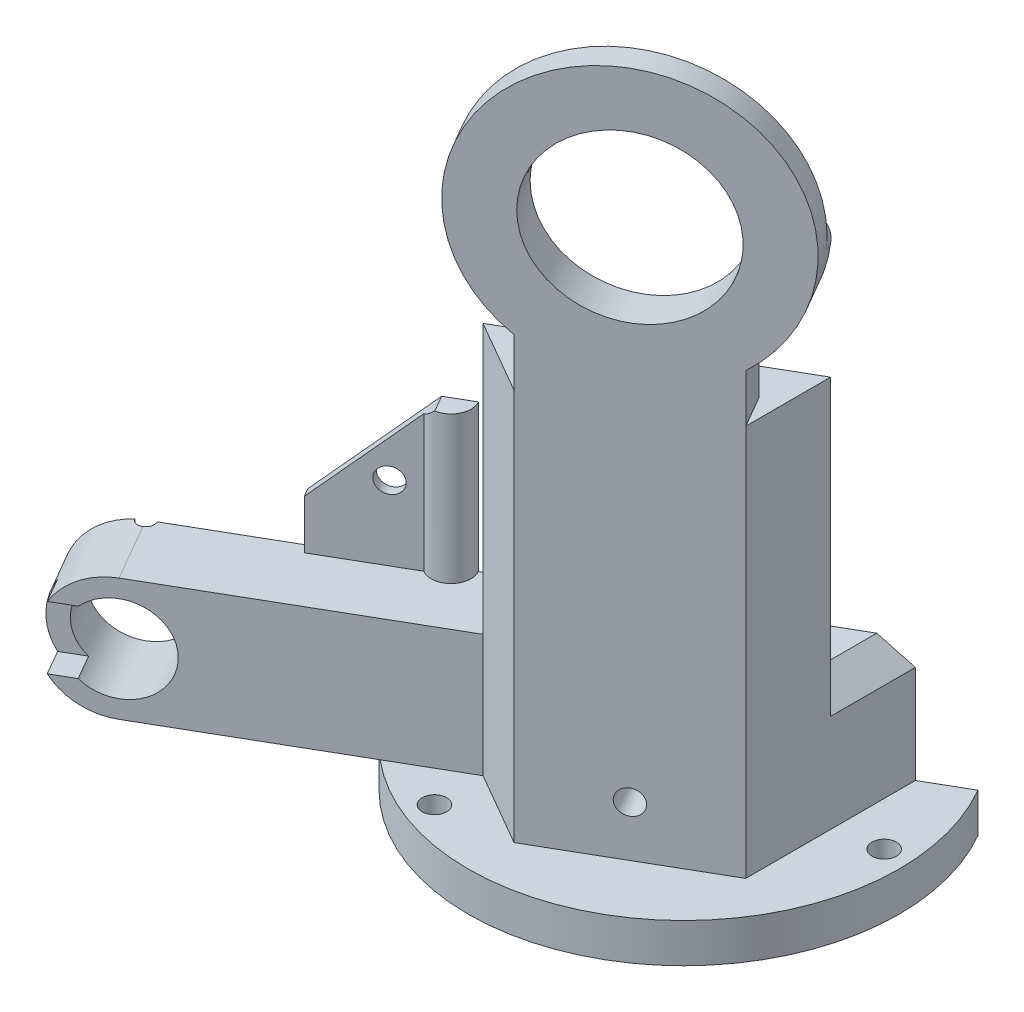
from build123d import *

# Parameters (mm, degrees)
SKETCH4_R            = 55.88
BOSS_EXTRUDE2_DEPTH  = 10.16
BOSS_EXTRUDE4_DEPTH  = 101.6
BOSS_EXTRUDE5_DEPTH  = 9.525
BOSS_EXTRUDE6_START  = -9.525
BOSS_EXTRUDE6_DEPTH  = 9.525
CUT_EXTRUDE4_REACH   = 223.16
SKETCH12_R           = 21.5
SKETCH13_W           = 38.1
SKETCH13_H           = 69.85
CUT_EXTRUDE5_DEPTH   = 76.2
BOSS_EXTRUDE10_DEPTH = 19.05
SKETCH28_R           = 11.2395
CUT_EXTRUDE9_DEPTH   = 38.1
CUT_EXTRUDE10_DEPTH  = 7.366
CHAMFER1_SIZE        = 6.35
SKETCH30_R           = 2.1
CUT_EXTRUDE11_DEPTH  = 7.366
SKETCH31_R           = 3.175
CUT_EXTRUDE12_DEPTH  = 223.900333216
BOSS_EXTRUDE11_DEPTH = 38.1
CHAMFER2_SIZE        = 25.4
CUT_EXTRUDE13_REACH  = 233.204
SKETCH34_R           = 3.175
SKETCH35_R           = 3.175
CUT_EXTRUDE14_DEPTH  = 246.746626534
SKETCH36_W           = 63.5
SKETCH36_H           = 36.709955102
CUT_EXTRUDE15_DEPTH  = 63.5
FILLET1_R            = 6.35
SKETCH37_W           = 210.742334846
SKETCH37_H           = 201.224939079
CUT_EXTRUDE16_DEPTH  = 232.093968202


with BuildPart() as part:
    # Sketch4 → Boss-Extrude2 (new body)
    with BuildSketch(Plane(origin=(0, 0, 0), x_dir=(1, 0, 0), z_dir=(0, 1, 0))):
        with Locations(Location((0, 0, 0), (0, 0, 270))):
            Circle(SKETCH4_R)
    extrude(amount=BOSS_EXTRUDE2_DEPTH)

    # Sketch8 → Boss-Extrude4 (add)
    with BuildSketch(Plane(origin=(0, 10.16, 0), x_dir=(1, 0, 0), z_dir=(0, 1, 0))):
        Polygon((0, 43.994090512), (-38.1, 21.997045256), (-38.1, -21.997045256), (0, -43.994090512), (38.1, -21.997045256), (38.1, 21.997045256), align=None)
    extrude(amount=BOSS_EXTRUDE4_DEPTH)

    # Sketch9 → Boss-Extrude5 (add)
    with BuildSketch(Plane(origin=(-19.05, 0, -32.995567884), x_dir=(-0.8660254037844386, 0, 0.5000000000000003), z_dir=(-0.5000000000000002, 0, -0.8660254037844385))):
        with BuildLine():
            Line((21.997045256, 111.76), (-21.997045256, 111.76))
            Line((-21.997045256, 111.76), (-21.997045256, 124.225996336))
            ThreePointArc((-21.997045256, 124.225996336), (0, 188.144153123), (21.997045256, 124.225996336))
            Line((21.997045256, 124.225996336), (21.997045256, 111.76))
        make_face()
    extrude(amount=-BOSS_EXTRUDE5_DEPTH)

    # Sketch10 → Boss-Extrude6 (add)
    with BuildSketch(Plane(origin=(19.05, 0, 32.995567884), x_dir=(0.8660254037844386, 0, -0.5000000000000001), z_dir=(0.5000000000000001, 0, 0.8660254037844386)).offset(BOSS_EXTRUDE6_START)):
        with BuildLine():
            Line((-21.997045256, 111.76), (21.997045256, 111.76))
            Line((21.997045256, 111.76), (21.997045256, 124.225996336))
            ThreePointArc((21.997045256, 124.225996336), (0, 188.144153123), (-21.997045256, 124.225996336))
            Line((-21.997045256, 124.225996336), (-21.997045256, 111.76))
        make_face()
    extrude(amount=BOSS_EXTRUDE6_DEPTH)

    # Cut-Extrude4: up to this face of the body (flat: up to its plane)
    cut_extrude4_end = Plane(part.part.faces().sort_by_distance((19.05, 104.643172711, 32.995567884))[0])
    # Sketch12 → Cut-Extrude4 (cut, up to the picked face)
    with BuildSketch(Plane(origin=(-19.05, 0, -32.995567884), x_dir=(-0.8660254037844386, 0, 0.5000000000000003), z_dir=(-0.5000000000000002, 0, -0.8660254037844385)), mode=Mode.PRIVATE) as cut_extrude4_sk1:
        with Locations((0, 152.4)):
            Circle(SKETCH12_R)
    cut_extrude4_tool1 = split(extrude(cut_extrude4_sk1.sketch, amount=-CUT_EXTRUDE4_REACH, mode=Mode.PRIVATE), bisect_by=cut_extrude4_end, keep=Keep.BOTH, mode=Mode.PRIVATE)
    add(cut_extrude4_tool1.solids().sort_by(Axis((-19.05, 152.4, -32.995568), (0.5000000000000002, 0, 0.8660254037844385)))[0], mode=Mode.SUBTRACT)

    # Sketch13 → Cut-Extrude5 (cut, symmetric)
    with BuildSketch(Plane(origin=(-19.05, 0, 10.998522628), x_dir=(0.5000000000000002, 0, 0.8660254037844386), z_dir=(-0.8660254037844385, 0, 0.5000000000000001))):
        with Locations((0, 76.835)):
            Rectangle(SKETCH13_W, SKETCH13_H)
    extrude(amount=CUT_EXTRUDE5_DEPTH, both=True, mode=Mode.SUBTRACT)

    # Sketch22 → Boss-Extrude10 (add, symmetric)
    with BuildSketch(Plane(origin=(0, 0, 0), x_dir=(-0.8660254037844386, 0, 0.5000000000000001), z_dir=(-0.5000000000000001, 0, -0.8660254037844386))):
        with BuildLine():
            Line((43.994090512, 41.91), (102.10102108, 41.91))
            ThreePointArc((102.10102108, 41.91), (117.97602108, 26.035), (102.10102108, 10.16))
            Line((102.10102108, 10.16), (43.994090512, 10.16))
            Line((43.994090512, 10.16), (21.997045256, 10.16))
            Line((21.997045256, 10.16), (21.997045256, 41.91))
            Line((21.997045256, 41.91), (43.994090512, 41.91))
        make_face()
    extrude(amount=BOSS_EXTRUDE10_DEPTH, both=True)

    # Sketch28 → Cut-Extrude9 (cut)
    with BuildSketch(Plane(origin=(9.525, 0, 16.497783942), x_dir=(0.8660254037844386, 0, -0.5000000000000001), z_dir=(0.5000000000000001, 0, 0.8660254037844386))):
        with Locations((-102.10102108, 26.035)):
            Circle(SKETCH28_R)
    extrude(amount=-CUT_EXTRUDE9_DEPTH, mode=Mode.SUBTRACT)

    # Sketch29 → Cut-Extrude10 (cut)
    with BuildSketch(Plane(origin=(9.525, 0, 16.497783942), x_dir=(0.8660254037844386, 0, -0.5000000000000001), z_dir=(0.5000000000000001, 0, 0.8660254037844386))):
        with BuildLine():
            Line((-115.737415068, 17.907), (-109.863879848, 17.907))
            ThreePointArc((-109.863879848, 17.907), (-113.34052108, 26.035), (-109.863879848, 34.163))
            Line((-109.863879848, 34.163), (-115.737415068, 34.163))
            ThreePointArc((-115.737415068, 34.163), (-117.97602108, 26.035), (-115.737415068, 17.907))
        make_face()
    extrude(amount=-CUT_EXTRUDE10_DEPTH, mode=Mode.SUBTRACT)

    # Chamfer1
    chamfer1_edges = [part.edges().sort_by_distance(p)[0] for p in [
        (38.1, 41.91, -10.998522628),
        (28.575, 41.91, -27.49630657),
    ]]
    chamfer(chamfer1_edges, length=CHAMFER1_SIZE)

    # Sketch30 → Cut-Extrude11 (cut)
    with BuildSketch(Plane(origin=(0, 41.91, 0), x_dir=(1, 0, 0), z_dir=(0, 1, 0))):
        with Locations(Location((-88.422078008, -51.05051054, 0), (0, 0, 270))):
            Circle(SKETCH30_R)
    extrude(amount=-CUT_EXTRUDE11_DEPTH, mode=Mode.SUBTRACT)

    # Sketch31 → Cut-Extrude12 (cut, through all)
    with BuildSketch(Plane(origin=(0, 10.16, 0), x_dir=(1, 0, 0), z_dir=(0, 1, 0))):
        with Locations(Location((-49.089000823, 6.594762938, 0), (0, 0, 270))):
            Circle(SKETCH31_R)
        with Locations(Location((26.925278647, 41.57222955, 0), (0, 0, 270))):
            Circle(SKETCH31_R)
    cut_extrude12 = extrude(amount=-CUT_EXTRUDE12_DEPTH, mode=Mode.SUBTRACT)

    # Mirror1: Cut-Extrude12 across plane
    add(cut_extrude12.mirror(Plane(origin=(0, 0, 0), x_dir=(-0.8660254037844386, 0, 0.5000000000000001), z_dir=(-0.5000000000000001, 0, -0.8660254037844386))), mode=Mode.SUBTRACT)

    # Sketch33 → Boss-Extrude11 (add)
    with BuildSketch(Plane(origin=(0, 41.91, 0), x_dir=(1, 0, 0), z_dir=(0, 1, 0))):
        with BuildLine():
            Line((-43.411916389, -22.079834386), (-63.092428819, -33.442383535))
            Line((-63.092428819, -33.442383535), (-61.800298466, -35.680418955))
            Line((-61.800298466, -35.680418955), (-60.542722832, -37.858603849))
            Line((-60.542722832, -37.858603849), (-40.91541904, -26.504074545))
            ThreePointArc((-40.91541904, -26.504074545), (-33.742060338, -19.539834386), (-43.411916389, -22.079834386))
        make_face()
    extrude(amount=BOSS_EXTRUDE11_DEPTH)

    # Chamfer2
    chamfer2_edges = [part.edges().sort_by_distance(p)[0] for p in [
        (-61.817575825, 80.01, 35.650493692),
    ]]
    chamfer(chamfer2_edges, length=CHAMFER2_SIZE)

    # Cut-Extrude13: up to this plane
    cut_extrude13_end = Plane(origin=(-60.542722832, 80.01, 37.858603849), z_dir=(-0.500750644235671, 0, -0.8655915851587056))
    # Sketch34 → Cut-Extrude13 (cut, up to the surface)
    with BuildSketch(Plane(origin=(-1.292130352, 0, -2.23803542), x_dir=(-0.8660254037844386, 0, 0.5000000000000003), z_dir=(-0.5000000000000002, 0, -0.8660254037844385)), mode=Mode.PRIVATE) as cut_extrude13_sk1:
        with Locations((55.184849848, 61.159110234)):
            Circle(SKETCH34_R)
    cut_extrude13_tool1 = split(extrude(cut_extrude13_sk1.sketch, amount=-CUT_EXTRUDE13_REACH, mode=Mode.PRIVATE), bisect_by=cut_extrude13_end, keep=Keep.BOTH, mode=Mode.PRIVATE)
    add(cut_extrude13_tool1.solids().sort_by_distance((-49.083612, 61.15911, 25.35439))[0], mode=Mode.SUBTRACT)

    # Sketch35 → Cut-Extrude14 (cut, through all)
    with BuildSketch(Plane(origin=(19.05, 0, 32.995567884), x_dir=(0.8660254037844386, 0, -0.5000000000000001), z_dir=(0.5000000000000001, 0, 0.8660254037844386))):
        with Locations((0, 23.280078313)):
            Circle(SKETCH35_R)
    extrude(amount=-CUT_EXTRUDE14_DEPTH, mode=Mode.SUBTRACT)

    # Sketch36 → Cut-Extrude15 (cut, symmetric)
    with BuildSketch(Plane(origin=(-19.05, 0, 10.998522628), x_dir=(0.5000000000000004, 0, 0.8660254037844384), z_dir=(-0.8660254037844384, 0, 0.5000000000000004))):
        with Locations((0, 174.660846527)):
            Rectangle(SKETCH36_W, SKETCH36_H)
    extrude(amount=CUT_EXTRUDE15_DEPTH, both=True, mode=Mode.SUBTRACT)

    # Fillet1
    # the kernel refuses this fillet: 6.35 mm, written as the material it takes off along each edge
    with BuildSketch(Plane(origin=(12.272597523, 156.305868976, -21.027711652), x_dir=(0.04103819462533737, -0.9988766133891899, -0.023693412713994805), z_dir=(-0.5000000000000003, 0, -0.8660254037844386))) as fillet1_piece_1:
        with BuildLine():
            CenterArc((6.655634068, -6.291985478), FILLET1_R, 97.750867839, 84.965214409)
            Line((0.312767573, -6.592891819), (0, 0))
            ThreePointArc((0, 0), (2.899617679, -0.196427123), (5.799235358, 0))
        make_face()
    extrude(amount=19.675766287, mode=Mode.SUBTRACT)
    with BuildSketch(Plane(origin=(-24.346831236, 156.305868976, 0.114525399), x_dir=(-0.04103819462533767, -0.9988766133891899, 0.023693412713994975), z_dir=(-0.5000000000000003, 0, -0.8660254037844386))) as fillet1_piece_2:
        with BuildLine():
            CenterArc((6.655634068, 6.291985478), FILLET1_R, 177.283917752, 84.965214409)
            Line((0.312767573, 6.592891819), (0, 0))
            ThreePointArc((0, 0), (2.899617679, 0.196427123), (5.799235358, 0))
        make_face()
    extrude(amount=19.675766287, mode=Mode.SUBTRACT)
    with BuildSketch(Plane(origin=(-14.894977291, 156.305868976, 45.261361242), x_dir=(-0.011364190914464473, -0.999913899736612, 0.0065611186835884), z_dir=(-0.5000000000000002, 0, -0.8660254037844386)), Plane(origin=(-36.459231913, 156.305868976, 7.91097661), x_dir=(-0.011364190914463116, -0.999913899736612, 0.0065611186835876165), z_dir=(-0.5000000000000002, 0, -0.8660254037844386))) as fillet1_piece_3:
        with BuildLine():
            CenterArc((6.26760006, -6.320536654), FILLET1_R, 84.478464497, 94.769665105)
            Line((-0.081853204, -6.237210446), (0, 0))
            ThreePointArc((0, 0), (3.439298151, 0.165849191), (6.878596303, 0))
        make_face()
    extrude(amount=20.371490756, mode=Mode.SUBTRACT)
    with BuildSketch(Plane(origin=(25.080722669, 156.305868976, -27.619132734), x_dir=(0.011364190914465366, -0.999913899736612, -0.00656111868358885), z_dir=(-0.5000000000000002, 0, -0.8660254037844386)), Plane(origin=(46.644977291, 156.305868976, 9.731251898), x_dir=(0.011364190914466365, -0.999913899736612, -0.006561118683589426), z_dir=(-0.5000000000000002, 0, -0.8660254037844386))) as fillet1_piece_4:
        with BuildLine():
            CenterArc((6.26760006, 6.320536654), FILLET1_R, 180.751870398, 94.769665105)
            Line((-0.081853204, 6.237210446), (0, 0))
            ThreePointArc((0, 0), (3.439298151, -0.165849191), (6.878596303, 0))
        make_face()
    extrude(amount=20.371490756, mode=Mode.SUBTRACT)

    # Sketch37 → Cut-Extrude16 (cut, through all)
    with BuildSketch(Plane(origin=(0, 0, 0), x_dir=(-0.8660254037844386, 0, 0.5000000000000001), z_dir=(-0.5000000000000001, 0, -0.8660254037844386))):
        with Locations((30.487295463, 97.29801522)):
            Rectangle(SKETCH37_W, SKETCH37_H)
    extrude(amount=CUT_EXTRUDE16_DEPTH, mode=Mode.SUBTRACT)


solid = part.part
